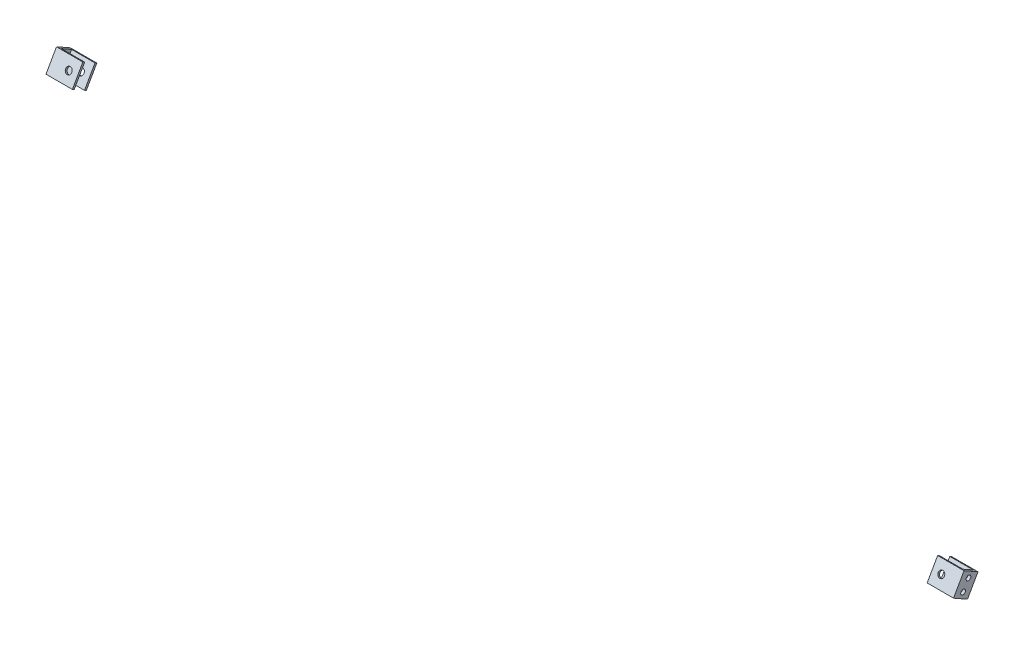
from build123d import *

# Parameters (mm, degrees)
SKETCH1_W           = 28.321
SKETCH1_H           = 22.86
SKETCH1_R           = 3.3782
BOSS_EXTRUDE1_DEPTH = 8.636
SKETCH2_W           = 31.794417924
SKETCH2_H           = 12.7
CUT_EXTRUDE1_DEPTH  = 671.801833822
SKETCH3_R           = 2.5527
CUT_EXTRUDE2_DEPTH  = 1374.04694071


with BuildPart() as part:
    # Sketch1 → Boss-Extrude1 (new, symmetric)
    with BuildSketch(Plane(origin=(0, -217.945214779, -384.948202745), x_dir=(-1, 0, 0), z_dir=(0, -0.4926838295770631, -0.8702083911760905))):
        with Locations((473.289499952, 1279.170858512)):
            Rectangle(SKETCH1_W, SKETCH1_H)
        with Locations((468.653999952, 1279.170858512)):
            Circle(SKETCH1_R, mode=Mode.SUBTRACT)
    extrude(amount=BOSS_EXTRUDE1_DEPTH, both=True)

    # Sketch2 → Cut-Extrude1 (cut, through all)
    with BuildSketch(Plane(origin=(0, 1103.198732914, -624.595421083), x_dir=(1, 0, 0), z_dir=(0, -0.8702083911760903, 0.49268382957706325))):
        with Locations((-468.37779099, -442.363239252)):
            Rectangle(SKETCH2_W, SKETCH2_H)
    extrude(amount=-CUT_EXTRUDE1_DEPTH, mode=Mode.SUBTRACT)

    # Sketch3 → Cut-Extrude2 (cut, through all)
    with BuildSketch(Plane.ZY.offset(487.449999952)):
        with Locations((-1018.065773102, 900.30586076)):
            Circle(SKETCH3_R)
        with Locations((-1012.284226898, 890.094139332)):
            Circle(SKETCH3_R)
        with Locations((0, 890.821943017)):
            Circle(SKETCH3_R)
    extrude(amount=-CUT_EXTRUDE2_DEPTH, mode=Mode.SUBTRACT)


with BuildPart() as body_2:
    # Mirror2: mirrored copy
    add(part.part.mirror(Plane(origin=(0, 0, 0), x_dir=(0, 0, 1), z_dir=(1, 0, 0))))


solid = Compound([part.part, body_2.part])
